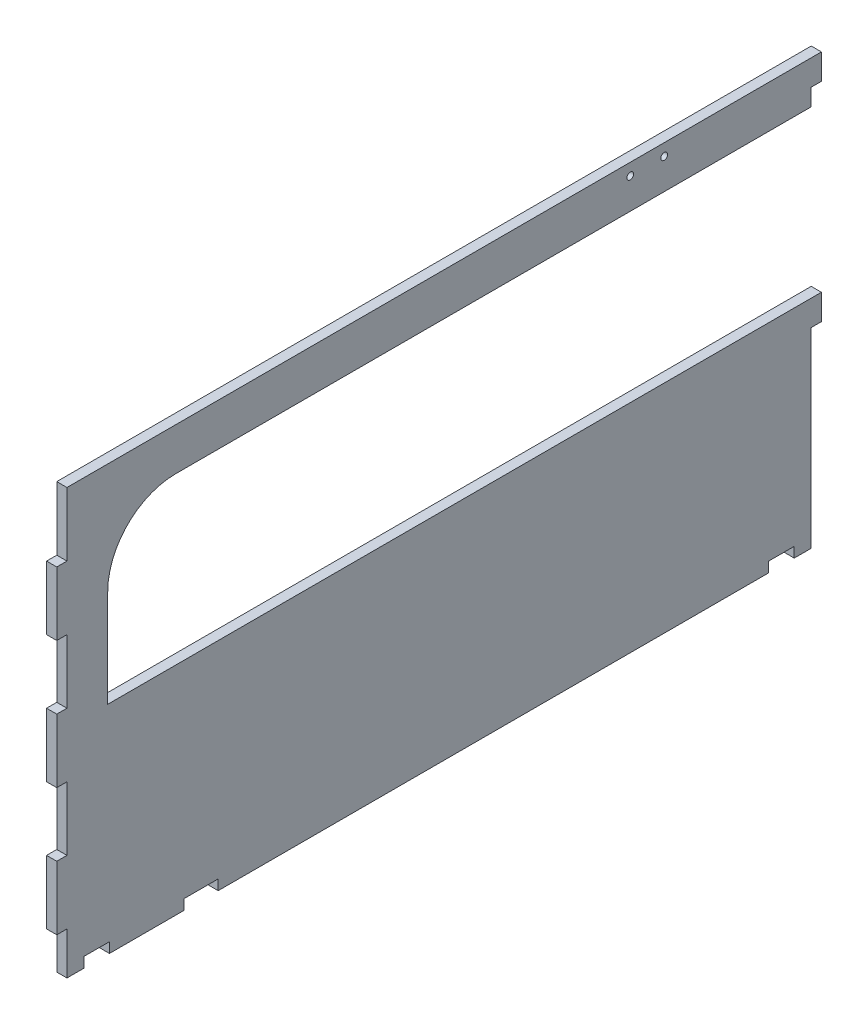
from build123d import *

# Parameters (mm, degrees)
BOSS_EXTRUDE1_DEPTH = 6
SKETCH2_W           = 6
SKETCH2_H           = 37.5
CUT_EXTRUDE1_DEPTH  = 6
LPATTERN1_COUNT     = 4
LPATTERN1_PITCH     = 75
FILLET1_R           = 40
SKETCH3_W           = 6
SKETCH3_H           = 10
SKETCH3_H_2         = 112.5
CUT_EXTRUDE2_DEPTH  = 515.816472153
SKETCH4_W           = 15
SKETCH4_H           = 6
CUT_EXTRUDE3_DEPTH  = 515.816472153
SKETCH5_R           = 2
CUT_EXTRUDE4_DEPTH  = 515.816472153
SKETCH6_W           = 20
SKETCH6_H           = 6
CUT_EXTRUDE5_DEPTH  = 515.816472153


with BuildPart() as part:
    # Sketch1 → Boss-Extrude1 (new body)
    with BuildSketch(Plane(origin=(0, 0, 0), x_dir=(0, 0, -1), z_dir=(1, 0, 0))):
        Polygon((450, 225), (450, 250), (0, 250), (0, 0), (450, 0), (450, 127.5), (30, 127.5), (30, 225), align=None)
    extrude(amount=BOSS_EXTRUDE1_DEPTH)

    # Sketch2 → Cut-Extrude1 (cut)
    with BuildSketch(Plane(origin=(6, 0, 0), x_dir=(0, 0, -1), z_dir=(1, 0, 0))):
        with Locations((3, 231.25)):
            Rectangle(SKETCH2_W, SKETCH2_H)
    cut_extrude1 = extrude(amount=-CUT_EXTRUDE1_DEPTH, mode=Mode.SUBTRACT)

    # LPattern1: Cut-Extrude1 ×4
    with Locations(*[(0, -i * LPATTERN1_PITCH, 0) for i in range(1, LPATTERN1_COUNT)]):
        add(cut_extrude1, mode=Mode.SUBTRACT)

    # Fillet1
    fillet1_edges = [part.edges().sort_by_distance(p)[0] for p in [
        (3, 225, -30),
    ]]
    fillet(fillet1_edges, radius=FILLET1_R)

    # Sketch3 → Cut-Extrude2 (cut, through all)
    with BuildSketch(Plane.ZY):
        with Locations((-447, 230)):
            Rectangle(SKETCH3_W, SKETCH3_H)
        with Locations((-447, 56.25)):
            Rectangle(SKETCH3_W, SKETCH3_H_2)
    extrude(amount=-CUT_EXTRUDE2_DEPTH, mode=Mode.SUBTRACT)

    # Sketch4 → Cut-Extrude3 (cut, through all)
    with BuildSketch(Plane.ZY):
        with Locations((-23.5, 3)):
            Rectangle(SKETCH4_W, SKETCH4_H)
        with Locations((-426.5, 3)):
            Rectangle(SKETCH4_W, SKETCH4_H)
    extrude(amount=-CUT_EXTRUDE3_DEPTH, mode=Mode.SUBTRACT)

    # Sketch5 → Cut-Extrude4 (cut, through all)
    with BuildSketch(Plane.ZY):
        with Locations((-357.5, 243)):
            Circle(SKETCH5_R)
        with Locations((-337.5, 243)):
            Circle(SKETCH5_R)
    extrude(amount=-CUT_EXTRUDE4_DEPTH, mode=Mode.SUBTRACT)

    # Sketch6 → Cut-Extrude5 (cut, through all)
    with BuildSketch(Plane.ZY):
        with Locations((-85, 3)):
            Rectangle(SKETCH6_W, SKETCH6_H)
    extrude(amount=-CUT_EXTRUDE5_DEPTH, mode=Mode.SUBTRACT)


solid = part.part
